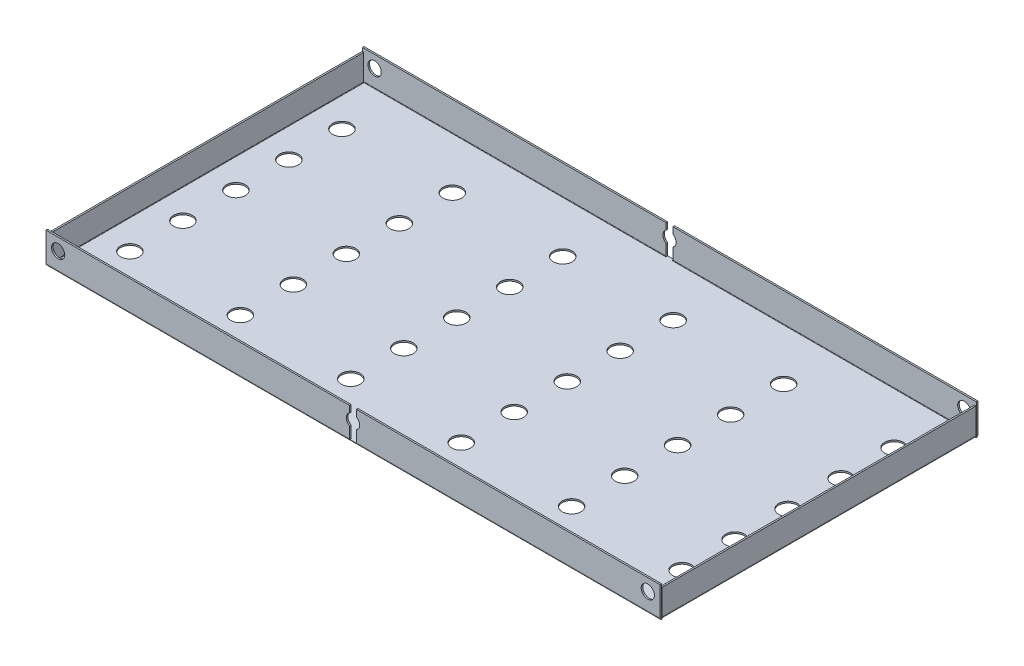
from build123d import *

# Parameters (mm, degrees)
SKETCH_1_W                         = 278
SKETCH_1_H                         = 144
SKETCH_1_R                         = 4.25
SM_BASE_FLANGE_1_DEPTH             = 0.7
SM_EDGE_FLANGE_1_STRIP_W           = 3.2
SM_EDGE_FLANGE_1_STRIP_H           = 0.7
SM_EDGE_FLANGE_1_STRIP_CUT_DEPTH   = 278
SM_EDGE_FLANGE_1_STRIP_2_W         = 3.2
SM_EDGE_FLANGE_1_STRIP_2_H         = 0.7
SM_EDGE_FLANGE_1_STRIP_CUT_2_DEPTH = 278
SM_EDGE_FLANGE_1_DEPTH             = 278
SM_EDGE_FLANGE_1_BEND_DEPTH        = 278
SKETCH_14_R                        = 3
CUT_EXTRUDE_1_DEPTH                = 10
SKETCH_15_R                        = 3
CUT_EXTRUDE_2_DEPTH                = 10
SKETCH_16_W                        = 3
SKETCH_16_H                        = 13.3
CUT_EXTRUDE_3_DEPTH                = 10
SKETCH_17_W                        = 3
SKETCH_17_H                        = 13.3
CUT_EXTRUDE_4_DEPTH                = 10
SM_EDGE_FLANGE_2_STRIP_W           = 3.2
SM_EDGE_FLANGE_2_STRIP_H           = 0.7
SM_EDGE_FLANGE_2_STRIP_CUT_DEPTH   = 142.2
SM_EDGE_FLANGE_2_STRIP_2_W         = 3.2
SM_EDGE_FLANGE_2_STRIP_2_H         = 0.7
SM_EDGE_FLANGE_2_STRIP_CUT_2_DEPTH = 142.2
SM_EDGE_FLANGE_2_DEPTH             = 142.2
SM_EDGE_FLANGE_2_BEND_DEPTH        = 142.2


# Sheet-metal steps are written as plain solids
with BuildPart() as part:
    # Sketch 1 → 基体-法兰1 (new body)
    with BuildSketch(Plane(origin=(0, 0, 0), x_dir=(1, 0, 0), z_dir=(0, 1, 0))):
        Rectangle(SKETCH_1_W, SKETCH_1_H)
        with Locations(Location((-125, -48, 0), (0, 0, 270))):
            Circle(SKETCH_1_R, mode=Mode.SUBTRACT)
        with Locations(Location((-125, -24, 0), (0, 0, 270))):
            Circle(SKETCH_1_R, mode=Mode.SUBTRACT)
        with Locations(Location((-125, 0, 0), (0, 0, 270))):
            Circle(SKETCH_1_R, mode=Mode.SUBTRACT)
        with Locations(Location((-125, 24, 0), (0, 0, 270))):
            Circle(SKETCH_1_R, mode=Mode.SUBTRACT)
        with Locations(Location((-125, 48, 0), (0, 0, 270))):
            Circle(SKETCH_1_R, mode=Mode.SUBTRACT)
        with Locations(Location((-75, -48, 0), (0, 0, 90))):
            Circle(SKETCH_1_R, mode=Mode.SUBTRACT)
        with Locations(Location((-75, -24, 0), (0, 0, 90))):
            Circle(SKETCH_1_R, mode=Mode.SUBTRACT)
        with Locations(Location((-75, 0, 0), (0, 0, 90))):
            Circle(SKETCH_1_R, mode=Mode.SUBTRACT)
        with Locations(Location((-75, 24, 0), (0, 0, 90))):
            Circle(SKETCH_1_R, mode=Mode.SUBTRACT)
        with Locations(Location((-75, 48, 0), (0, 0, 90))):
            Circle(SKETCH_1_R, mode=Mode.SUBTRACT)
        with Locations(Location((-25, -48, 0), (0, 0, 270))):
            Circle(SKETCH_1_R, mode=Mode.SUBTRACT)
        with Locations(Location((-25, -24, 0), (0, 0, 270))):
            Circle(SKETCH_1_R, mode=Mode.SUBTRACT)
        with Locations(Location((-25, 0, 0), (0, 0, 270))):
            Circle(SKETCH_1_R, mode=Mode.SUBTRACT)
        with Locations(Location((-25, 24, 0), (0, 0, 270))):
            Circle(SKETCH_1_R, mode=Mode.SUBTRACT)
        with Locations(Location((-25, 48, 0), (0, 0, 270))):
            Circle(SKETCH_1_R, mode=Mode.SUBTRACT)
        with Locations(Location((25, -48, 0), (0, 0, 90))):
            Circle(SKETCH_1_R, mode=Mode.SUBTRACT)
        with Locations(Location((25, -24, 0), (0, 0, 90))):
            Circle(SKETCH_1_R, mode=Mode.SUBTRACT)
        with Locations(Location((25, 0, 0), (0, 0, 90))):
            Circle(SKETCH_1_R, mode=Mode.SUBTRACT)
        with Locations(Location((25, 24, 0), (0, 0, 90))):
            Circle(SKETCH_1_R, mode=Mode.SUBTRACT)
        with Locations(Location((25, 48, 0), (0, 0, 90))):
            Circle(SKETCH_1_R, mode=Mode.SUBTRACT)
        with Locations(Location((75, 48, 0), (0, 0, 270))):
            Circle(SKETCH_1_R, mode=Mode.SUBTRACT)
        with Locations(Location((75, 24, 0), (0, 0, 270))):
            Circle(SKETCH_1_R, mode=Mode.SUBTRACT)
        with Locations(Location((75, 0, 0), (0, 0, 270))):
            Circle(SKETCH_1_R, mode=Mode.SUBTRACT)
        with Locations(Location((75, -24, 0), (0, 0, 270))):
            Circle(SKETCH_1_R, mode=Mode.SUBTRACT)
        with Locations(Location((75, -48, 0), (0, 0, 270))):
            Circle(SKETCH_1_R, mode=Mode.SUBTRACT)
        with Locations(Location((125, -48, 0), (0, 0, 90))):
            Circle(SKETCH_1_R, mode=Mode.SUBTRACT)
        with Locations(Location((125, -24, 0), (0, 0, 90))):
            Circle(SKETCH_1_R, mode=Mode.SUBTRACT)
        with Locations(Location((125, 0, 0), (0, 0, 90))):
            Circle(SKETCH_1_R, mode=Mode.SUBTRACT)
        with Locations(Location((125, 24, 0), (0, 0, 90))):
            Circle(SKETCH_1_R, mode=Mode.SUBTRACT)
        with Locations(Location((125, 48, 0), (0, 0, 90))):
            Circle(SKETCH_1_R, mode=Mode.SUBTRACT)
    extrude(amount=-SM_BASE_FLANGE_1_DEPTH)

    # 边线-法兰1 strip (across the edge) → 边线-法兰1 strip cut (cut)
    with BuildSketch(Plane(origin=(-139, 0, 72), x_dir=(0, 0, -1), z_dir=(1, 0, 0))):
        with Locations((-0.7, -0.35)):
            Rectangle(SM_EDGE_FLANGE_1_STRIP_W, SM_EDGE_FLANGE_1_STRIP_H)
    extrude(amount=SM_EDGE_FLANGE_1_STRIP_CUT_DEPTH, mode=Mode.SUBTRACT)

    # 边线-法兰1 strip 2 (across the edge) → 边线-法兰1 strip cut 2 (cut)
    with BuildSketch(Plane(origin=(139, 0, -72), x_dir=(0, 0, 1), z_dir=(-1, 0, 0))):
        with Locations((-0.7, -0.35)):
            Rectangle(SM_EDGE_FLANGE_1_STRIP_2_W, SM_EDGE_FLANGE_1_STRIP_2_H)
    extrude(amount=SM_EDGE_FLANGE_1_STRIP_CUT_2_DEPTH, mode=Mode.SUBTRACT)

    # 边线-法兰1 section (across the edge) → 边线-法兰1 (add)
    with BuildSketch(Plane(origin=(-139, 0, 72), x_dir=(0, 0, -1), z_dir=(1, 0, 0))):
        with BuildLine():
            Line((0, 0.2), (0, 13.3))
            Line((0, 13.3), (0.7, 13.3))
            Line((0.7, 13.3), (0.7, 0.2))
            ThreePointArc((0.7, 0.2), (0.758578644, 0.058578644), (0.9, 0))
            Line((0.9, 0), (0.9, -0.7))
            ThreePointArc((0.9, -0.7), (0.263603897, -0.436396103), (0, 0.2))
        make_face()
    extrude(amount=SM_EDGE_FLANGE_1_DEPTH)

    # 边线-法兰1 section 2 (across the edge) → 边线-法兰1 bend (add)
    with BuildSketch(Plane(origin=(139, 0, -72), x_dir=(0, 0, 1), z_dir=(-1, 0, 0))):
        with BuildLine():
            Line((0, 0.2), (0, 13.3))
            Line((0, 13.3), (0.7, 13.3))
            Line((0.7, 13.3), (0.7, 0.2))
            ThreePointArc((0.7, 0.2), (0.758578644, 0.058578644), (0.9, 0))
            Line((0.9, 0), (0.9, -0.7))
            ThreePointArc((0.9, -0.7), (0.263603897, -0.436396103), (0, 0.2))
        make_face()
    extrude(amount=SM_EDGE_FLANGE_1_BEND_DEPTH)

    # 草图14 → 切除-拉伸1 (cut)
    with BuildSketch(Plane(origin=(0, 0, 71.3), x_dir=(-1, 0, 0), z_dir=(0, 0, -1))):
        with Locations((-133.5, 7.8)):
            Circle(SKETCH_14_R)
        with Locations((0, 7.8)):
            Circle(SKETCH_14_R)
        with Locations((133.5, 7.8)):
            Circle(SKETCH_14_R)
    extrude(amount=-CUT_EXTRUDE_1_DEPTH, mode=Mode.SUBTRACT)

    # 草图15 → 切除-拉伸2 (cut)
    with BuildSketch(Plane(origin=(0, 0, -72), x_dir=(-1, 0, 0), z_dir=(0, 0, -1))):
        with Locations((-133.5, 7.8)):
            Circle(SKETCH_15_R)
        with Locations((0, 7.8)):
            Circle(SKETCH_15_R)
        with Locations((133.5, 7.8)):
            Circle(SKETCH_15_R)
    extrude(amount=-CUT_EXTRUDE_2_DEPTH, mode=Mode.SUBTRACT)

    # 草图16 → 切除-拉伸3 (cut)
    with BuildSketch(Plane(origin=(0, 0, -72), x_dir=(-1, 0, 0), z_dir=(0, 0, -1))):
        with Locations((0, 6.65)):
            Rectangle(SKETCH_16_W, SKETCH_16_H)
    extrude(amount=-CUT_EXTRUDE_3_DEPTH, mode=Mode.SUBTRACT)

    # 草图17 → 切除-拉伸4 (cut)
    with BuildSketch(Plane.XY.offset(72)):
        with Locations((0, 6.65)):
            Rectangle(SKETCH_17_W, SKETCH_17_H)
    extrude(amount=-CUT_EXTRUDE_4_DEPTH, mode=Mode.SUBTRACT)

    # 边线-法兰2 strip (across the edge) → 边线-法兰2 strip cut (cut)
    with BuildSketch(Plane(origin=(-139, 0, -71.1), x_dir=(1, 0, 0), z_dir=(0, 0, 1))):
        with Locations((-0.7, -0.35)):
            Rectangle(SM_EDGE_FLANGE_2_STRIP_W, SM_EDGE_FLANGE_2_STRIP_H)
    extrude(amount=SM_EDGE_FLANGE_2_STRIP_CUT_DEPTH, mode=Mode.SUBTRACT)

    # 边线-法兰2 strip 2 (across the edge) → 边线-法兰2 strip cut 2 (cut)
    with BuildSketch(Plane(origin=(139, 0, 71.1), x_dir=(-1, 0, 0), z_dir=(0, 0, -1))):
        with Locations((-0.7, -0.35)):
            Rectangle(SM_EDGE_FLANGE_2_STRIP_2_W, SM_EDGE_FLANGE_2_STRIP_2_H)
    extrude(amount=SM_EDGE_FLANGE_2_STRIP_CUT_2_DEPTH, mode=Mode.SUBTRACT)

    # 边线-法兰2 section (across the edge) → 边线-法兰2 (add)
    with BuildSketch(Plane(origin=(-139, 0, -71.1), x_dir=(1, 0, 0), z_dir=(0, 0, 1))):
        with BuildLine():
            Line((0, 0.2), (0, 11.8))
            Line((0, 11.8), (0.7, 11.8))
            Line((0.7, 11.8), (0.7, 0.2))
            ThreePointArc((0.7, 0.2), (0.758578644, 0.058578644), (0.9, 0))
            Line((0.9, 0), (0.9, -0.7))
            ThreePointArc((0.9, -0.7), (0.263603897, -0.436396103), (0, 0.2))
        make_face()
    extrude(amount=SM_EDGE_FLANGE_2_DEPTH)

    # 边线-法兰2 section 2 (across the edge) → 边线-法兰2 bend (add)
    with BuildSketch(Plane(origin=(139, 0, 71.1), x_dir=(-1, 0, 0), z_dir=(0, 0, -1))):
        with BuildLine():
            Line((0, 0.2), (0, 11.8))
            Line((0, 11.8), (0.7, 11.8))
            Line((0.7, 11.8), (0.7, 0.2))
            ThreePointArc((0.7, 0.2), (0.758578644, 0.058578644), (0.9, 0))
            Line((0.9, 0), (0.9, -0.7))
            ThreePointArc((0.9, -0.7), (0.263603897, -0.436396103), (0, 0.2))
        make_face()
    extrude(amount=SM_EDGE_FLANGE_2_BEND_DEPTH)


solid = part.part
